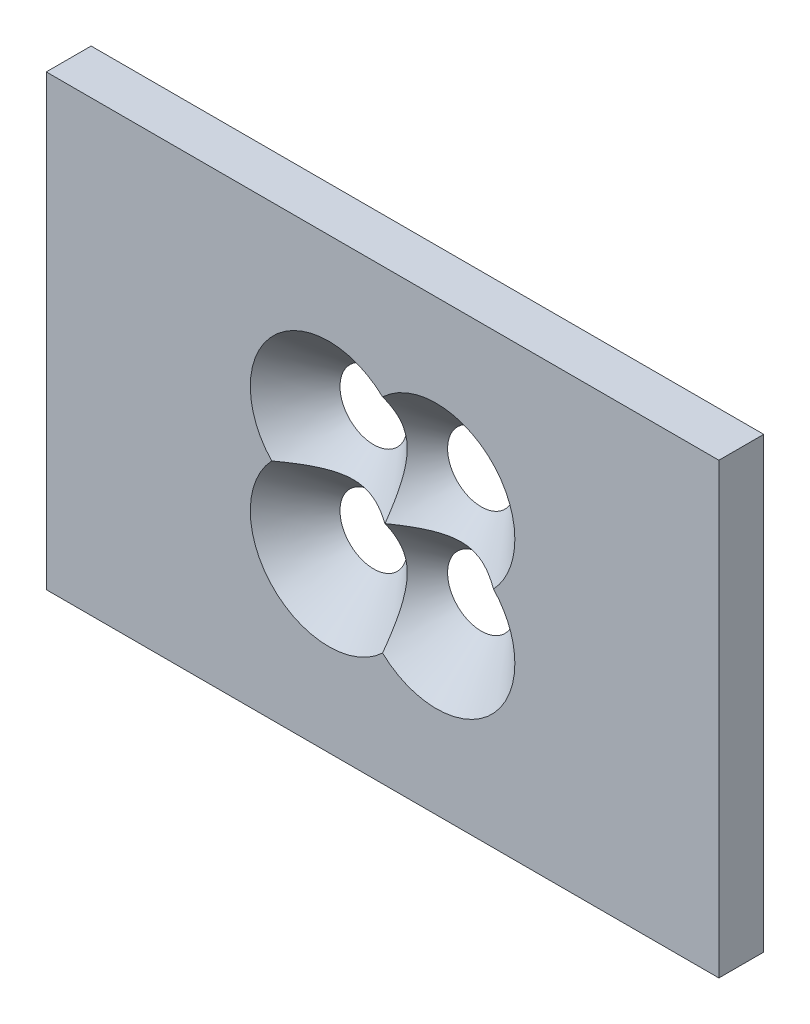
from build123d import *

# Parameters (mm, degrees)
SKETCH1_W           = 1500
SKETCH1_H           = 1000
SKETCH1_R           = 75
BOSS_EXTRUDE1_DEPTH = 100
CHAMFER1_SIZE       = 100


with BuildPart() as part:
    # Sketch1 → Boss-Extrude1 (new body)
    with BuildSketch(Plane.XY):
        Rectangle(SKETCH1_W, SKETCH1_H)
        with Locations((-120, 120)):
            Circle(SKETCH1_R, mode=Mode.SUBTRACT)
        with Locations((120, 120)):
            Circle(SKETCH1_R, mode=Mode.SUBTRACT)
        with Locations((120, -120)):
            Circle(SKETCH1_R, mode=Mode.SUBTRACT)
        with Locations((-120, -120)):
            Circle(SKETCH1_R, mode=Mode.SUBTRACT)
    extrude(amount=BOSS_EXTRUDE1_DEPTH)

    # Chamfer1
    # the kernel refuses this chamfer: 100 mm, written as the material it takes off along each edge
    with BuildSketch(Plane(origin=(-120, 120, 100), x_dir=(1, 0, 0), z_dir=(0, -1, 0))) as chamfer1_piece_1:
        Polygon((75, -CHAMFER1_SIZE), (75 + CHAMFER1_SIZE, 0), (75, 0), align=None)
    revolve(axis=Axis((-120, 120, 100), (0, 0, 1)), mode=Mode.SUBTRACT)
    with BuildSketch(Plane(origin=(120, 120, 100), x_dir=(1, 0, 0), z_dir=(0, -1, 0))) as chamfer1_piece_2:
        Polygon((75, -CHAMFER1_SIZE), (75 + CHAMFER1_SIZE, 0), (75, 0), align=None)
    revolve(axis=Axis((120, 120, 100), (0, 0, 1)), mode=Mode.SUBTRACT)
    with BuildSketch(Plane(origin=(120, -120, 100), x_dir=(1, 0, 0), z_dir=(0, -1, 0))) as chamfer1_piece_3:
        Polygon((75, -CHAMFER1_SIZE), (75 + CHAMFER1_SIZE, 0), (75, 0), align=None)
    revolve(axis=Axis((120, -120, 100), (0, 0, 1)), mode=Mode.SUBTRACT)
    with BuildSketch(Plane(origin=(-120, -120, 100), x_dir=(1, 0, 0), z_dir=(0, -1, 0))) as chamfer1_piece_4:
        Polygon((75, -CHAMFER1_SIZE), (75 + CHAMFER1_SIZE, 0), (75, 0), align=None)
    revolve(axis=Axis((-120, -120, 100), (0, 0, 1)), mode=Mode.SUBTRACT)


solid = part.part
